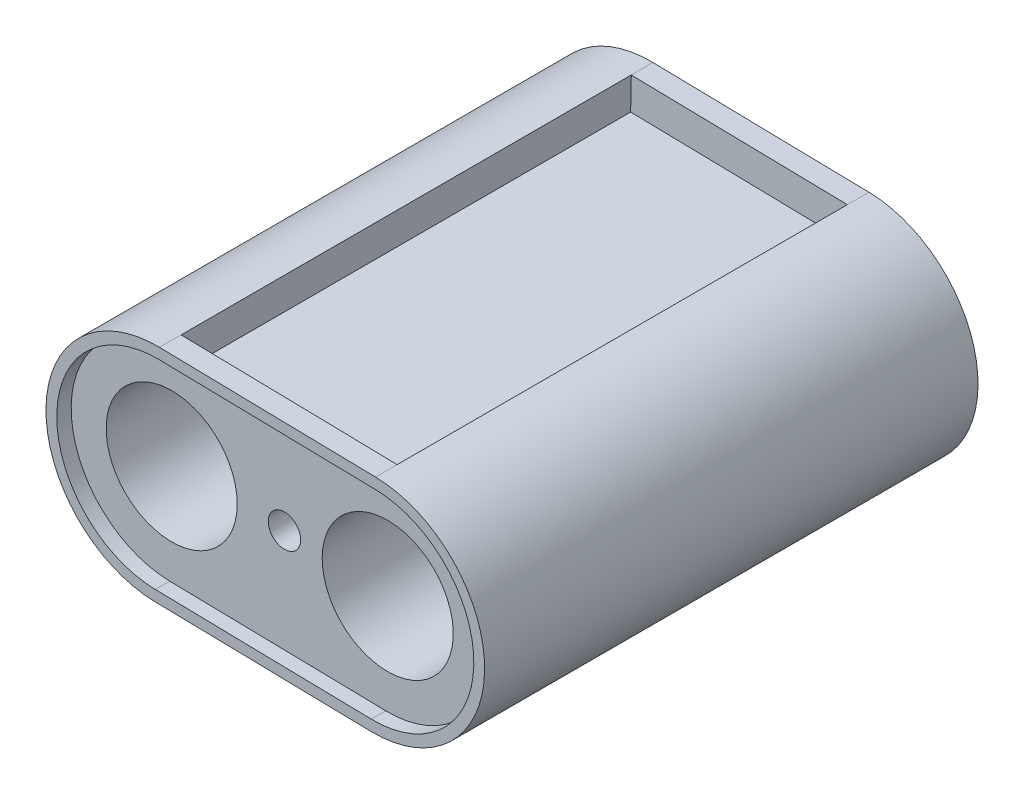
from build123d import *

# Parameters (mm, degrees)
SKETCH_1_R          = 9.1
EXTRUDE_1_DEPTH     = 65
EXTRUDE_2_DEPTH     = 2
SKETCH_3_R          = 2.25
CUT_EXTRUDE_1_DEPTH = 4.5
CUT_EXTRUDE_START   = -4.5
SKETCH_4_R          = 2.25
CUT_EXTRUDE_2_DEPTH = 4.5
EXTRUDE_START       = 1.5
EXTRUDE_3_DEPTH     = 1.5
SKETCH_7_W          = 30
SKETCH_7_H          = 62.5
CUT_EXTRUDE_4_DEPTH = 4.5
SKETCH_8_W          = 30
SKETCH_8_H          = 62.5
CUT_EXTRUDE_5_DEPTH = 4.5


with BuildPart() as part:
    # Эскиз1 → Бобышка-Вытянуть1 (new body)
    with BuildSketch(Plane.XY):
        with BuildLine():
            Line((-15.348477888, 15.359663741), (14.645527362, 14.759956259))
            ThreePointArc((14.645527362, 14.759956259), (29.785323334, -0.997609119), (14.027757956, -16.137405091))
            Line((14.027757956, -16.137405091), (-15.966247294, -15.537697609))
            ThreePointArc((-15.966247294, -15.537697609), (-31.106043266, 0.219867769), (-15.348477888, 15.359663741))
        make_face()
        with Locations((-15.657362591, -0.089016934)):
            Circle(SKETCH_1_R, mode=Mode.SUBTRACT)
        with Locations((14.336642659, -0.688724416)):
            Circle(SKETCH_1_R, mode=Mode.SUBTRACT)
    extrude(amount=EXTRUDE_1_DEPTH)

    # Эскиз2 → Бобышка-Вытянуть2 (add)
    with BuildSketch(Plane.XY.offset(65)):
        with BuildLine():
            Line((-15.966247294, -15.537697609), (14.027757956, -16.137405091))
            ThreePointArc((14.027757956, -16.137405091), (29.785323334, -0.997609119), (14.645527362, 14.759956259))
            Line((14.645527362, 14.759956259), (-15.348477888, 15.359663741))
            ThreePointArc((-15.348477888, 15.359663741), (-31.106043266, 0.219867769), (-15.966247294, -15.537697609))
        make_face()
        with BuildLine():
            Line((-15.378463262, 13.859963479), (14.615541988, 13.260255996))
            ThreePointArc((14.615541988, 13.260255996), (28.285623072, -0.967623745), (14.05774333, -14.637704829))
            Line((14.05774333, -14.637704829), (-15.93626192, -14.037997346))
            ThreePointArc((-15.93626192, -14.037997346), (-29.606343003, 0.189882395), (-15.378463262, 13.859963479))
        make_face(mode=Mode.SUBTRACT)
    extrude(amount=EXTRUDE_2_DEPTH)

    # Эскиз3 → Вырез-Вытянуть1 (cut)
    with BuildSketch(Plane.XY.offset(65)):
        Circle(SKETCH_3_R)
    extrude(amount=-CUT_EXTRUDE_1_DEPTH, mode=Mode.SUBTRACT)

    # Эскиз4 → Вырез-Вытянуть2 (cut)
    with BuildSketch(Plane(origin=(0, 0, 0), x_dir=(-1, 0, 0), z_dir=(0, 0, -1)).offset(CUT_EXTRUDE_START)):
        Circle(SKETCH_4_R)
    extrude(amount=CUT_EXTRUDE_2_DEPTH, mode=Mode.SUBTRACT)

    # Эскиз5 → Бобышка-Вытянуть3 (add)
    with BuildSketch(Plane(origin=(0, 0, 0), x_dir=(-1, 0, 0), z_dir=(0, 0, -1)).offset(EXTRUDE_START)):
        with BuildLine():
            Line((15.966247294, -15.537697609), (-14.027757956, -16.137405091))
            ThreePointArc((-14.027757956, -16.137405091), (-29.785323334, -0.997609119), (-14.645527362, 14.759956259))
            Line((-14.645527362, 14.759956259), (15.348477888, 15.359663741))
            ThreePointArc((15.348477888, 15.359663741), (31.106043266, 0.219867769), (15.966247294, -15.537697609))
        make_face()
        with BuildLine():
            Line((-14.615541988, 13.260255996), (15.378463262, 13.859963479))
            ThreePointArc((15.378463262, 13.859963479), (29.606343003, 0.189882395), (15.93626192, -14.037997346))
            Line((15.93626192, -14.037997346), (-14.05774333, -14.637704829))
            ThreePointArc((-14.05774333, -14.637704829), (-28.285623072, -0.967623745), (-14.615541988, 13.260255996))
        make_face(mode=Mode.SUBTRACT)
    extrude(amount=-EXTRUDE_3_DEPTH)

    # Эскиз7 → Вырез-Вытянуть4 (cut)
    with BuildSketch(Plane(origin=(0.300848748, 15.046767274, 0), x_dir=(0.9998001749990679, -0.0199902494189853, 0), z_dir=(0.0199902494189853, 0.999800174999068, 0))):
        with Locations((-0.652454388, -32.75)):
            Rectangle(SKETCH_7_W, SKETCH_7_H)
    extrude(amount=-CUT_EXTRUDE_4_DEPTH, mode=Mode.SUBTRACT)

    # Эскиз8 → Вырез-Вытянуть5 (cut)
    with BuildSketch(Plane(origin=(-0.316920658, -15.850594076, 0), x_dir=(-0.9998001749990679, 0.0199902494189853, 0), z_dir=(-0.0199902494189853, -0.999800174999068, 0))):
        with Locations((0.652454388, -32.75)):
            Rectangle(SKETCH_8_W, SKETCH_8_H)
    extrude(amount=-CUT_EXTRUDE_5_DEPTH, mode=Mode.SUBTRACT)


solid = part.part
